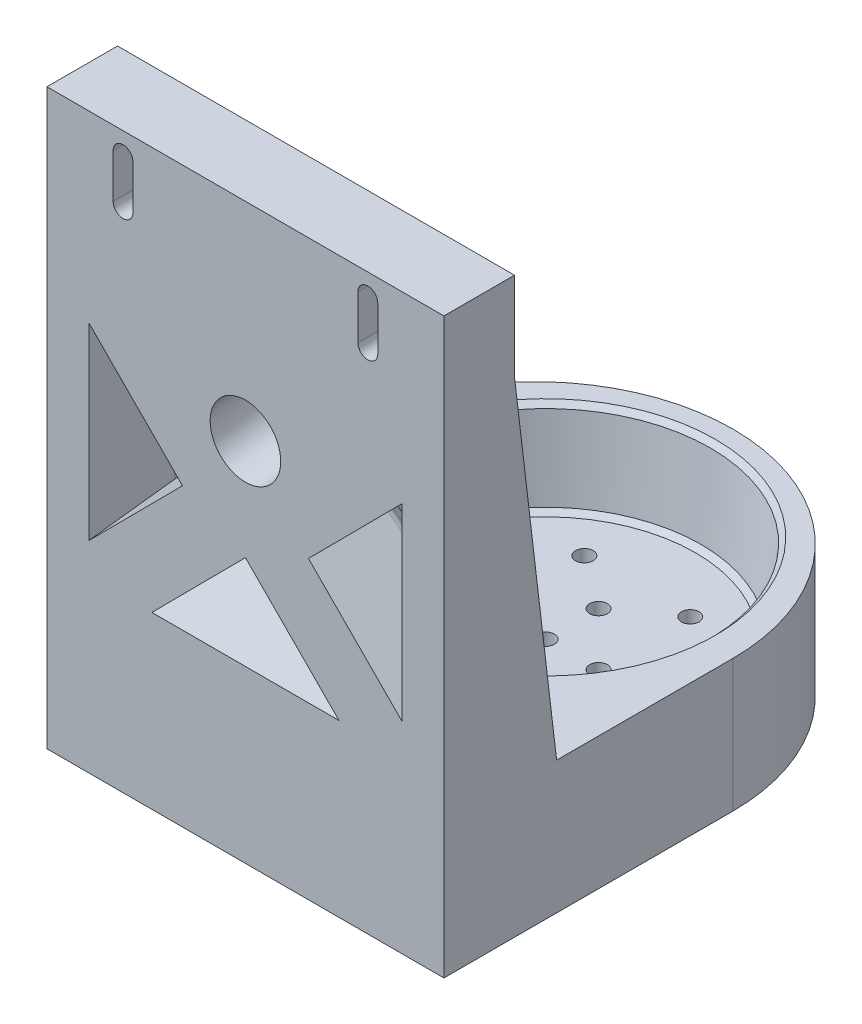
from build123d import *
from OCP.BRepFilletAPI import BRepFilletAPI_MakeChamfer

# Parameters (mm, degrees)
BOSS_EXTRUDE1_DEPTH = 90
CUT_EXTRUDE1_DEPTH  = 165.439594476
SKETCH4_R           = 37.5
CUT_EXTRUDE2_DEPTH  = 20
CUT_EXTRUDE2_DRAFT  = -6.81
SKETCH5_R           = 8
CUT_EXTRUDE3_DEPTH  = 160.138304628
SKETCH6_R           = 10
CUT_EXTRUDE4_DEPTH  = 2
FILLET1_R           = 45
CUT_EXTRUDE5_DEPTH  = 160.138304628
CHAMFER1_SIZE       = 3
CHAMFER2_SIZE       = 1
CHAMFER2_SIZE2      = 1.14368379
FILLET3_R           = 2
SKETCH8_R           = 2
CUT_EXTRUDE6_DEPTH  = 173.409396496


with BuildPart() as part:
    # Sketch1 → Boss-Extrude1 (new body)
    with BuildSketch(Plane(origin=(0, 0, 0), x_dir=(0, 0, -1), z_dir=(1, 0, 0))):
        Polygon((0, 0), (85, 0), (85, -30), (-25.553583916, -30), (-25.553583916, 100), (-9.553583916, 100), (-9.553583916, 80), align=None)
    extrude(amount=BOSS_EXTRUDE1_DEPTH)

    # Sketch2 → Cut-Extrude1 (cut, through all)
    with BuildSketch(Plane(origin=(0, 0, 9.553583916), x_dir=(-1, 0, 0), z_dir=(0, 0, -1))):
        with BuildLine():
            Line((-70.5, 95), (-70.5, 85))
            ThreePointArc((-70.5, 85), (-72.75, 82.75), (-75, 85))
            Line((-75, 85), (-75, 95))
            ThreePointArc((-75, 95), (-72.75, 97.25), (-70.5, 95))
        make_face()
        with BuildLine():
            Line((-19.5, 95), (-19.5, 85))
            ThreePointArc((-19.5, 85), (-17.25, 82.75), (-15, 85))
            Line((-15, 85), (-15, 95))
            ThreePointArc((-15, 95), (-17.25, 97.25), (-19.5, 95))
        make_face()
    extrude(amount=-CUT_EXTRUDE1_DEPTH, mode=Mode.SUBTRACT)


with BuildPart() as cut_extrude2_tool:
    # Sketch4 → Cut-Extrude2 (with draft: the straight prism first)
    with BuildSketch(Plane(origin=(0, 0, 0), x_dir=(1, 0, 0), z_dir=(0, 1, 0))):
        with Locations((45, 42.5)):
            Circle(SKETCH4_R)
    extrude(amount=-CUT_EXTRUDE2_DEPTH)
    # Cut-Extrude2: the draft: its side faces are tilted about the plane it starts from
    cut_extrude2_sides = [cut_extrude2_tool.faces().sort_by_distance(p)[0] for p in [
        (7.5, -10, -42.5),
    ]]
    draft(cut_extrude2_sides, Plane(origin=(0, 0, 0), x_dir=(1, 0, 0), z_dir=(0, 1, 0)), CUT_EXTRUDE2_DRAFT)


with BuildPart() as part_1:
    add(part.part)

    # Cut-Extrude2: cut by cut_extrude2_tool
    add(cut_extrude2_tool.part, mode=Mode.SUBTRACT)

    # Sketch5 → Cut-Extrude3 (cut, through all)
    with BuildSketch(Plane(origin=(0, 0, 0), x_dir=(-1, 0, 0), z_dir=(0, 0.11857727167698189, -0.9929448275919681))):
        with Locations(Location((-45, 55.568424123, 0), (0, 0, 90))):
            Circle(SKETCH5_R)
    extrude(amount=-CUT_EXTRUDE3_DEPTH, mode=Mode.SUBTRACT)

    # Sketch6 → Cut-Extrude4 (cut)
    with BuildSketch(Plane(origin=(0, 0, 0), x_dir=(-1, 0, 0), z_dir=(0, 0.11857727167698189, -0.9929448275919681))):
        with Locations(Location((-45, 55.568424123, 0), (0, 0, 90))):
            Circle(SKETCH6_R)
    extrude(amount=-CUT_EXTRUDE4_DEPTH, mode=Mode.SUBTRACT)

    # Fillet1
    fillet1_edges = [part_1.edges().sort_by_distance(p)[0] for p in [
        (0, -15, -85),
        (90, -15, -85),
    ]]
    fillet(fillet1_edges, radius=FILLET1_R - 0.0001)  # a hair under: the kernel refuses the full size

    # Sketch7 → Cut-Extrude5 (cut, through all)
    with BuildSketch(Plane(origin=(0, 0, 0), x_dir=(-1, 0, 0), z_dir=(0, 0.11857727167698176, -0.9929448275919681))):
        Polygon((-45, 32.853259254), (-66.213203436, 11.640055819), (-23.786796564, 11.640055819), align=None)
        Polygon((-80.494028285, 18.572434405), (-59.280824849, 39.78563784), (-80.494028285, 60.998841276), align=None)
        Polygon((-30.719175151, 39.78563784), (-9.505971715, 60.998841276), (-9.505971715, 18.572434405), align=None)
    extrude(amount=-CUT_EXTRUDE5_DEPTH, mode=Mode.SUBTRACT)

    # Chamfer1
    chamfer1_edges = [part_1.edges().sort_by_distance(p)[0] for p in [
        (34.393398282, 22.089703532, 2.637947955),
        (55.606601718, 22.089703532, 2.637947955),
        (45, 11.557933218, 1.380246061),
        (20.112573433, 28.973172992, 3.459970494),
        (9.505971715, 39.504943306, 4.717672387),
        (20.112573433, 50.03671362, 5.97537428),
        (80.494028285, 39.504943306, 4.717672387),
        (69.887426567, 28.973172992, 3.459970494),
        (69.887426567, 50.03671362, 5.97537428),
    ]]
    chamfer(chamfer1_edges, length=CHAMFER1_SIZE)

    # Chamfer2: one chamfer whose edges measure the first distance from different faces: ONE call of the kernel's chamfer builder (chamfer() names one face for all edges)
    chamfer2_edges_1 = [part_1.edges().sort_by_distance(p)[0] for p in [
        (9.888395979, -20, -42.5),
    ]]
    chamfer2_side_1 = [part_1.faces().sort_by_distance(p)[0] for p in [
        (8.694197989, -10, -42.5),
    ]]
    chamfer2_edges_2 = [part_1.edges().sort_by_distance(p)[0] for p in [
        (7.5, 0, -42.5),
    ]]
    chamfer2_side_2 = [part_1.faces().sort_by_distance(p)[0] for p in [
        (1.23794184, 0, -20.00005),
    ]]
    chamfer2 = BRepFilletAPI_MakeChamfer(part_1.part.solid().wrapped)
    for e in chamfer2_edges_1:
        chamfer2.Add(CHAMFER2_SIZE, CHAMFER2_SIZE2, e.wrapped, chamfer2_side_1[0].wrapped)  # the first distance lies on this face
    for e in chamfer2_edges_2:
        chamfer2.Add(CHAMFER2_SIZE, CHAMFER2_SIZE2, e.wrapped, chamfer2_side_2[0].wrapped)  # the first distance lies on this face
    add(Compound.cast(chamfer2.Shape()), mode=Mode.REPLACE)

    # Fillet3
    fillet3_edges = [part_1.edges().sort_by_distance(p)[0] for p in [
        (45, 11.202201403, 4.359080544),
        (55.606601718, 21.733971717, 5.616782437),
        (34.393398282, 21.733971717, 5.616782437),
        (20.112573433, 28.617441177, 6.438804976),
        (9.505971715, 39.149211491, 7.69650687),
        (20.112573433, 49.680981805, 8.954208763),
        (69.887426567, 28.617441177, 6.438804976),
        (80.494028285, 39.149211491, 7.69650687),
        (69.887426567, 49.680981805, 8.954208763),
    ]]
    fillet(fillet3_edges, radius=FILLET3_R)

    # Sketch8 → Cut-Extrude6 (cut, through all)
    with BuildSketch(Plane(origin=(0, -20, 0), x_dir=(1, 0, 0), z_dir=(0, 1, 0))):
        with Locations(Location((45, 42.5, 0), (0, 0, 270))):
            Circle(SKETCH8_R)
        with Locations(Location((45, 54.5, 0), (0, 0, 270))):
            Circle(SKETCH8_R)
        with Locations(Location((21, 42.5, 0), (0, 0, 270))):
            Circle(SKETCH8_R)
        with Locations(Location((57, 42.5, 0), (0, 0, 270))):
            Circle(SKETCH8_R)
        with Locations(Location((45, 30.5, 0), (0, 0, 270))):
            Circle(SKETCH8_R)
        with Locations(Location((33, 42.5, 0), (0, 0, 270))):
            Circle(SKETCH8_R)
        with Locations(Location((33, 63.284609691, 0), (0, 0, 270))):
            Circle(SKETCH8_R)
        with Locations(Location((57, 63.284609691, 0), (0, 0, 270))):
            Circle(SKETCH8_R)
        with Locations(Location((69, 42.5, 0), (0, 0, 270))):
            Circle(SKETCH8_R)
        with Locations(Location((57, 21.715390309, 0), (0, 0, 270))):
            Circle(SKETCH8_R)
        with Locations(Location((33, 21.715390309, 0), (0, 0, 270))):
            Circle(SKETCH8_R)
    extrude(amount=-CUT_EXTRUDE6_DEPTH, mode=Mode.SUBTRACT)


solid = part_1.part
